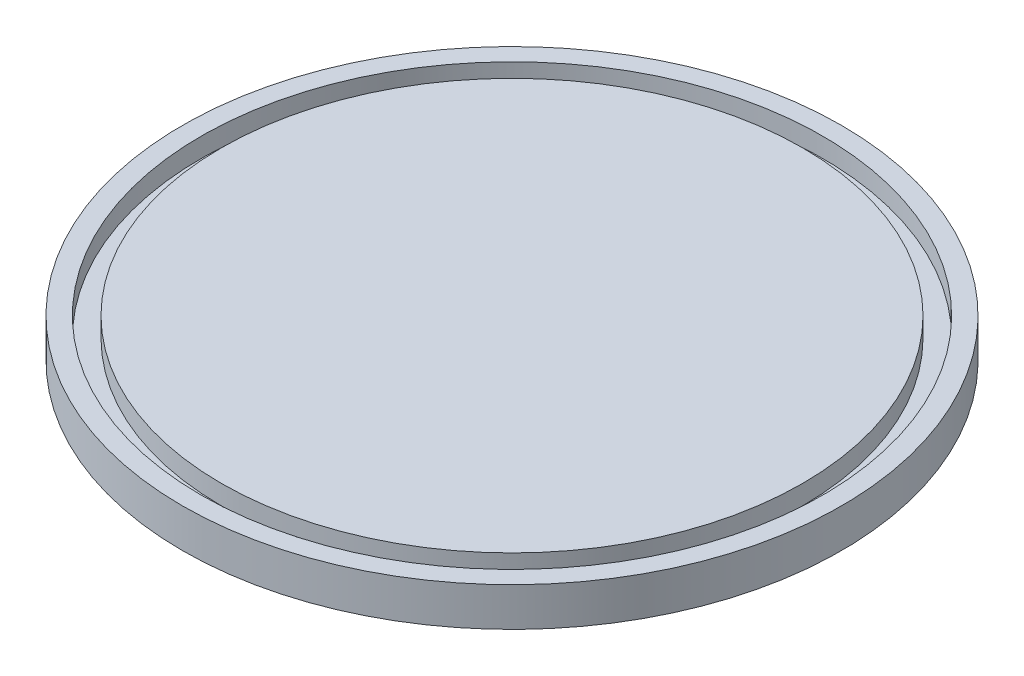
from build123d import *


with BuildPart() as part:
    # Sketch2 → Revolve1 (revolve)
    with BuildSketch(Plane.XY):
        Polygon((0, 0), (-30, 0), (-30, -2), (-32.088061302, -2), (-32.088061302, 0), (-34.016778293, 0), (-34.016778293, -4), (0, -4), align=None)
    revolve(axis=Axis((0, 100, 0), (0, -1, 0)))


solid = part.part
